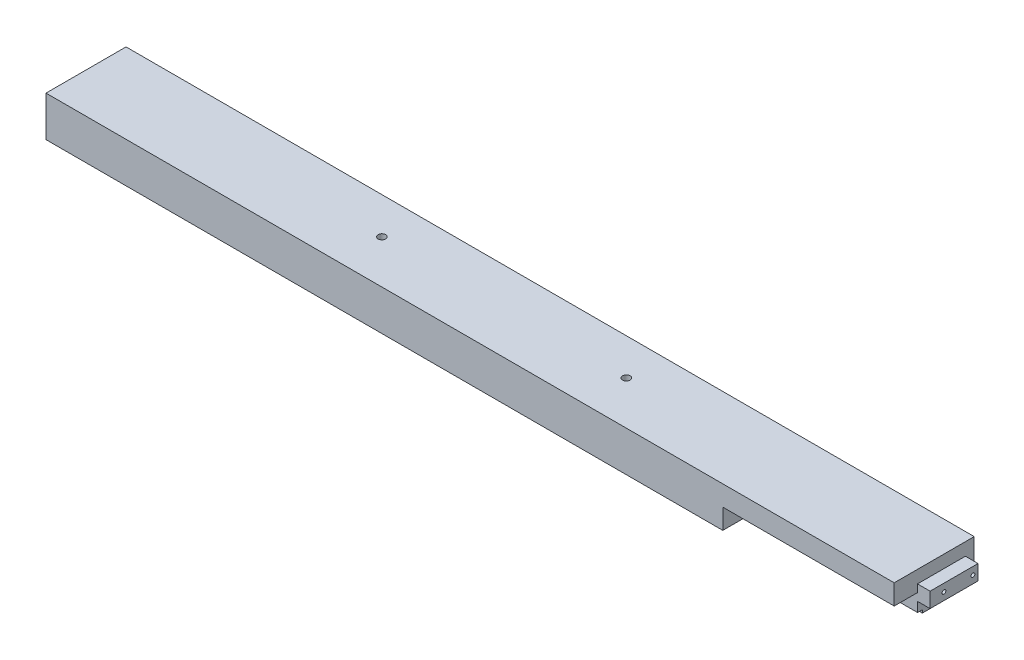
from build123d import *

# Parameters (mm, degrees)
SKETCH1_W           = 2136.775
SKETCH1_H           = 201.6125
BOSS_EXTRUDE1_DEPTH = 101.6
SKETCH2_R           = 9.525
CUT_EXTRUDE1_DEPTH  = 1078.931496059
SKETCH3_R           = 4.7625
BOSS_EXTRUDE2_DEPTH = 31.75
CUT_EXTRUDE2_DEPTH  = 431.8
SKETCH5_R           = 11.1125
CUT_EXTRUDE3_DEPTH  = 69.85


with BuildPart() as part:
    # Sketch1 → Boss-Extrude1 (new body)
    with BuildSketch(Plane(origin=(0, 0, 0), x_dir=(1, 0, 0), z_dir=(0, 1, 0))):
        Rectangle(SKETCH1_W, SKETCH1_H)
    extrude(amount=BOSS_EXTRUDE1_DEPTH)

    # Sketch2 → Cut-Extrude1 (cut, through all)
    with BuildSketch(Plane(origin=(0, 101.6, 0), x_dir=(1, 0, 0), z_dir=(0, 1, 0))):
        with Locations((-331.7875, 8.73125)):
            Circle(SKETCH2_R)
        with Locations((284.1625, 8.73125)):
            Circle(SKETCH2_R)
    extrude(amount=-CUT_EXTRUDE1_DEPTH, mode=Mode.SUBTRACT)

    # Sketch3 → Boss-Extrude2 (add)
    with BuildSketch(Plane(origin=(1068.3875, 0, 0), x_dir=(0, 0, -1), z_dir=(1, 0, 0))):
        Polygon((78.58125, 69.85), (-42.06875, 69.85), (-42.06875, 50.8), (-42.06875, 31.75), (78.58125, 31.75), align=None)
        with Locations((-7.14375, 50.8)):
            Circle(SKETCH3_R, mode=Mode.SUBTRACT)
        with Locations((65.88125, 50.8)):
            Circle(SKETCH3_R, mode=Mode.SUBTRACT)
    extrude(amount=BOSS_EXTRUDE2_DEPTH)

    # Sketch3<3> → Cut-Extrude2 (cut)
    with BuildSketch(Plane(origin=(1068.3875, 0, 0), x_dir=(0, 0, -1), z_dir=(1, 0, 0))):
        Polygon((-42.06875, 31.75), (-42.06875, 50.8), (-100.80625, 50.8), (-100.80625, 0), (-29.932015023, 0), (-29.932015023, 7.312255735), (-42.06875, 7.312255735), align=None)
    extrude(amount=-CUT_EXTRUDE2_DEPTH, mode=Mode.SUBTRACT)

    # Sketch5 → Cut-Extrude3 (cut)
    with BuildSketch(Plane.XZ):
        with Locations((1009.306684953, 7.14375)):
            Circle(SKETCH5_R)
        with Locations((1009.306684953, -65.88125)):
            Circle(SKETCH5_R)
    extrude(amount=-CUT_EXTRUDE3_DEPTH, mode=Mode.SUBTRACT)


solid = part.part
